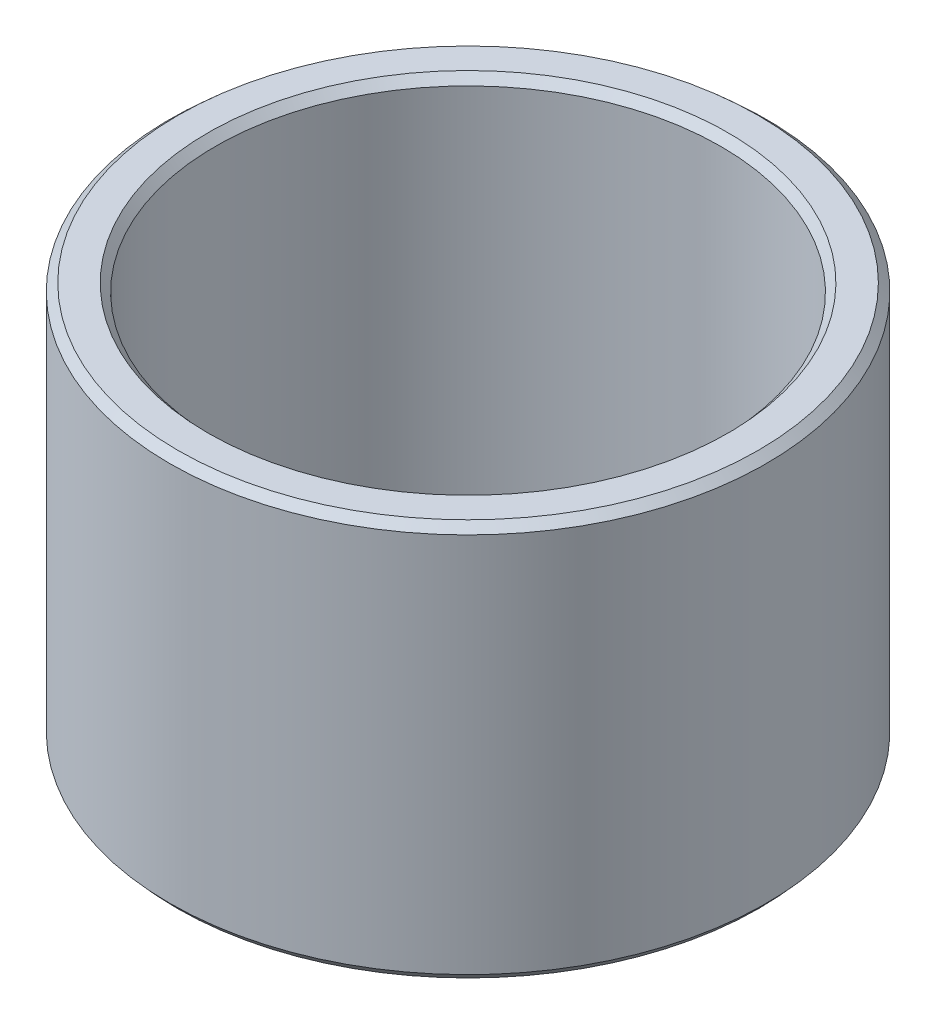
from build123d import *
from OCP.BRepFilletAPI import BRepFilletAPI_MakeChamfer

# Parameters (mm, degrees)
SKETCH1_R           = 50
BOSS_EXTRUDE1_DEPTH = 66.430956773
SKETCH2_R           = 42.369692594
CUT_EXTRUDE1_DEPTH  = 98.020987512
CHAMFER1_SIZE       = 1.236396717
CHAMFER1_SIZE2      = 1.361736398


with BuildPart() as part:
    # Sketch1 → Boss-Extrude1 (new body)
    with BuildSketch(Plane(origin=(0, 0, 0), x_dir=(1, 0, 0), z_dir=(0, 1, 0))):
        Circle(SKETCH1_R)
    extrude(amount=BOSS_EXTRUDE1_DEPTH)

    # Sketch2 → Cut-Extrude1 (cut, through all)
    with BuildSketch(Plane(origin=(0, 0, 0), x_dir=(1, 0, 0), z_dir=(0, 1, 0))):
        Circle(SKETCH2_R)
    extrude(amount=CUT_EXTRUDE1_DEPTH, mode=Mode.SUBTRACT)

    # Chamfer1: one chamfer whose edges measure the first distance from different faces: ONE call of the kernel's chamfer builder (chamfer() names one face for all edges)
    chamfer1_edges_1 = [part.edges().sort_by_distance(p)[0] for p in [
        (-42.369692594, 66.430956773, 0),
    ]]
    chamfer1_side_1 = [part.faces().sort_by_distance(p)[0] for p in [
        (-48.585786438, 66.430956773, 0),
    ]]
    chamfer1_edges_2 = [part.edges().sort_by_distance(p)[0] for p in [
        (-42.369692594, 0, 0),
    ]]
    chamfer1_side_2 = [part.faces().sort_by_distance(p)[0] for p in [
        (-42.369692594, 33.215478387, 0),
    ]]
    chamfer1_edges_3 = [part.edges().sort_by_distance(p)[0] for p in [
        (-50, 0, 0),
    ]]
    chamfer1_side_3 = [part.faces().sort_by_distance(p)[0] for p in [
        (-48.585786438, 0, 0),
    ]]
    chamfer1_edges_4 = [part.edges().sort_by_distance(p)[0] for p in [
        (-50, 66.430956773, 0),
    ]]
    chamfer1_side_4 = [part.faces().sort_by_distance(p)[0] for p in [
        (-50, 33.215478387, 0),
    ]]
    chamfer1 = BRepFilletAPI_MakeChamfer(part.part.solid().wrapped)
    for e in chamfer1_edges_1:
        chamfer1.Add(CHAMFER1_SIZE, CHAMFER1_SIZE2, e.wrapped, chamfer1_side_1[0].wrapped)  # the first distance lies on this face
    for e in chamfer1_edges_2:
        chamfer1.Add(CHAMFER1_SIZE, CHAMFER1_SIZE2, e.wrapped, chamfer1_side_2[0].wrapped)  # the first distance lies on this face
    for e in chamfer1_edges_3:
        chamfer1.Add(CHAMFER1_SIZE, CHAMFER1_SIZE2, e.wrapped, chamfer1_side_3[0].wrapped)  # the first distance lies on this face
    for e in chamfer1_edges_4:
        chamfer1.Add(CHAMFER1_SIZE, CHAMFER1_SIZE2, e.wrapped, chamfer1_side_4[0].wrapped)  # the first distance lies on this face
    add(Compound.cast(chamfer1.Shape()), mode=Mode.REPLACE)


solid = part.part
